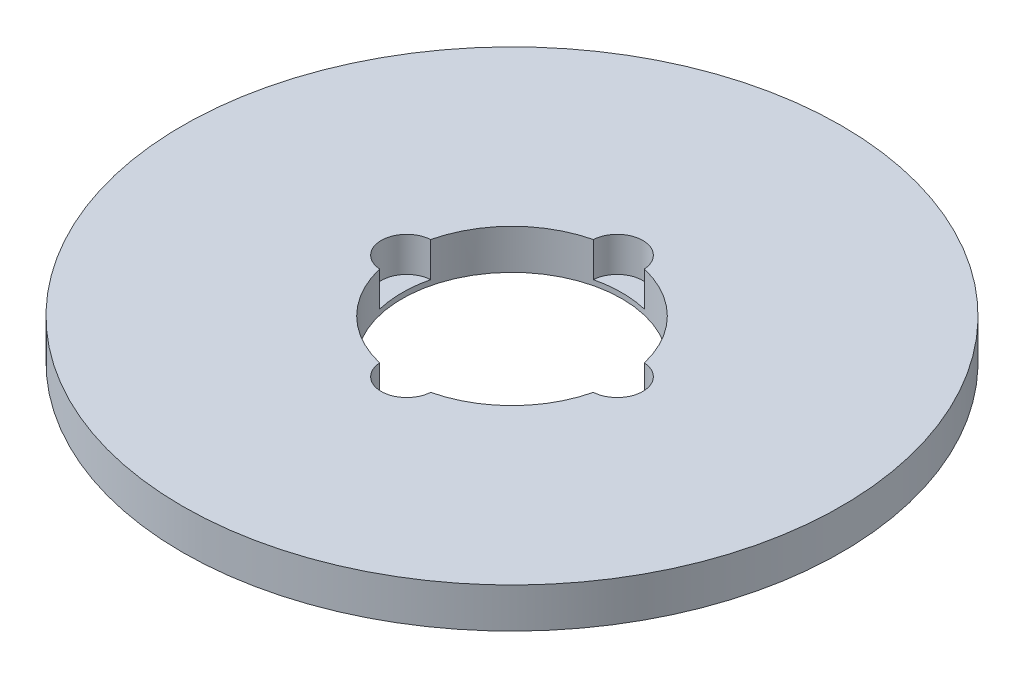
from build123d import *

# Parameters (mm, degrees)
SKETCH1_R           = 82.5
BOSS_EXTRUDE1_DEPTH = 10
SKETCH2_R           = 27.5
CUT_EXTRUDE1_DEPTH  = 118.100384286
SKETCH3_R           = 6.401645326
CUT_EXTRUDE2_DEPTH  = 8.697088467
CIRPATTERN1_COUNT   = 4


with BuildPart() as part:
    # Sketch1 → Boss-Extrude1 (new body)
    with BuildSketch(Plane(origin=(0, 0, 0), x_dir=(1, 0, 0), z_dir=(0, 1, 0))):
        Circle(SKETCH1_R)
    extrude(amount=BOSS_EXTRUDE1_DEPTH)

    # Sketch2 → Cut-Extrude1 (cut, through all)
    with BuildSketch(Plane(origin=(0, 0, 0), x_dir=(1, 0, 0), z_dir=(0, 1, 0))):
        Circle(SKETCH2_R)
    extrude(amount=CUT_EXTRUDE1_DEPTH, mode=Mode.SUBTRACT)

    # Sketch3 → Cut-Extrude2 (cut)
    with BuildSketch(Plane(origin=(0, 10, 0), x_dir=(1, 0, 0), z_dir=(0, 1, 0))):
        with Locations((-26.344042575, 0)):
            Circle(SKETCH3_R)
    cut_extrude2 = extrude(amount=-CUT_EXTRUDE2_DEPTH, mode=Mode.SUBTRACT)

    # CirPattern1: Cut-Extrude2 ×4 about axis
    cirpattern1_axis = Axis((0, 0, 0), (0, 1, 0))
    for i in range(1, CIRPATTERN1_COUNT):
        add(cut_extrude2.rotate(cirpattern1_axis, i * 360 / CIRPATTERN1_COUNT), mode=Mode.SUBTRACT)


solid = part.part
